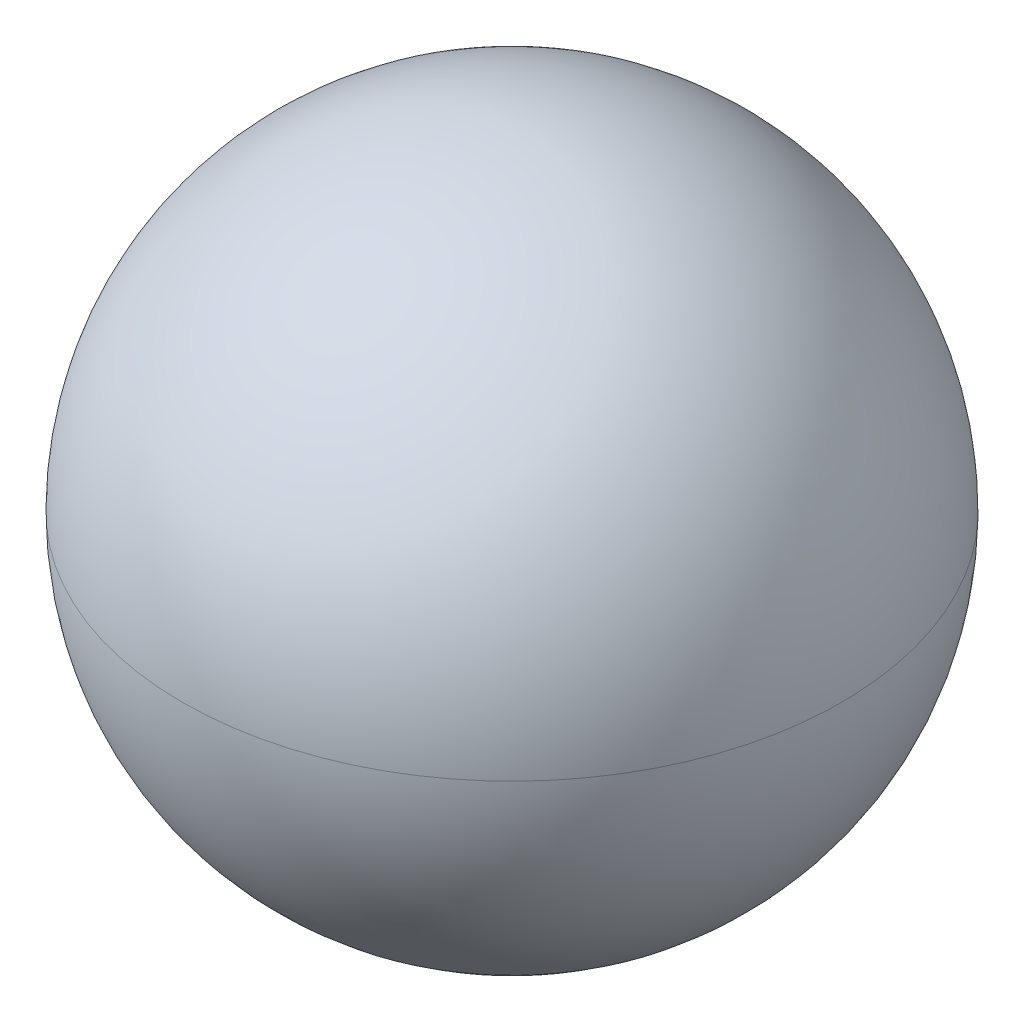
from build123d import *

# Parameters (mm, degrees)
SKETCH1_R           = 3.26
BOSS_EXTRUDE1_DEPTH = 6.5
FILLET1_R           = 3.26
FILLET2_R           = 3.26


with BuildPart() as part:
    # Sketch1 → Boss-Extrude1 (new body)
    with BuildSketch(Plane(origin=(0, 0, 0), x_dir=(1, 0, 0), z_dir=(0, 1, 0))):
        with Locations(Location((0, 0, 0), (0, 0, 90))):
            Circle(SKETCH1_R)
    extrude(amount=BOSS_EXTRUDE1_DEPTH)

    # Fillet1
    fillet1_edges = [part.edges().sort_by_distance(p)[0] for p in [
        (0, 6.5, 3.26),
    ]]
    fillet(fillet1_edges, radius=FILLET1_R)

    # Fillet2
    # the kernel refuses this fillet: 3.26 mm, written as the material it takes off along each edge
    with BuildSketch(Plane(origin=(0, 0, 0), x_dir=(0, 0, -1), z_dir=(1, 0, 0))) as fillet2_piece_1:
        with BuildLine():
            CenterArc((6.135e-05, 3.26), FILLET2_R, 270, 89.648489945)
            Line((6.135e-05, 0), (6.135e-05, -0.0652))
            Line((6.135e-05, -0.0652), (3.26, -0.0652))
            Line((3.26, -0.0652), (3.3252, 0))
            Line((3.3252, 0), (3.325198773, 3.2396))
            Line((3.325198773, 3.2396), (3.26, 3.24))
        make_face()
    revolve(axis=Axis((0, 0, 0), (0, 1, 0)), mode=Mode.SUBTRACT)


solid = part.part
